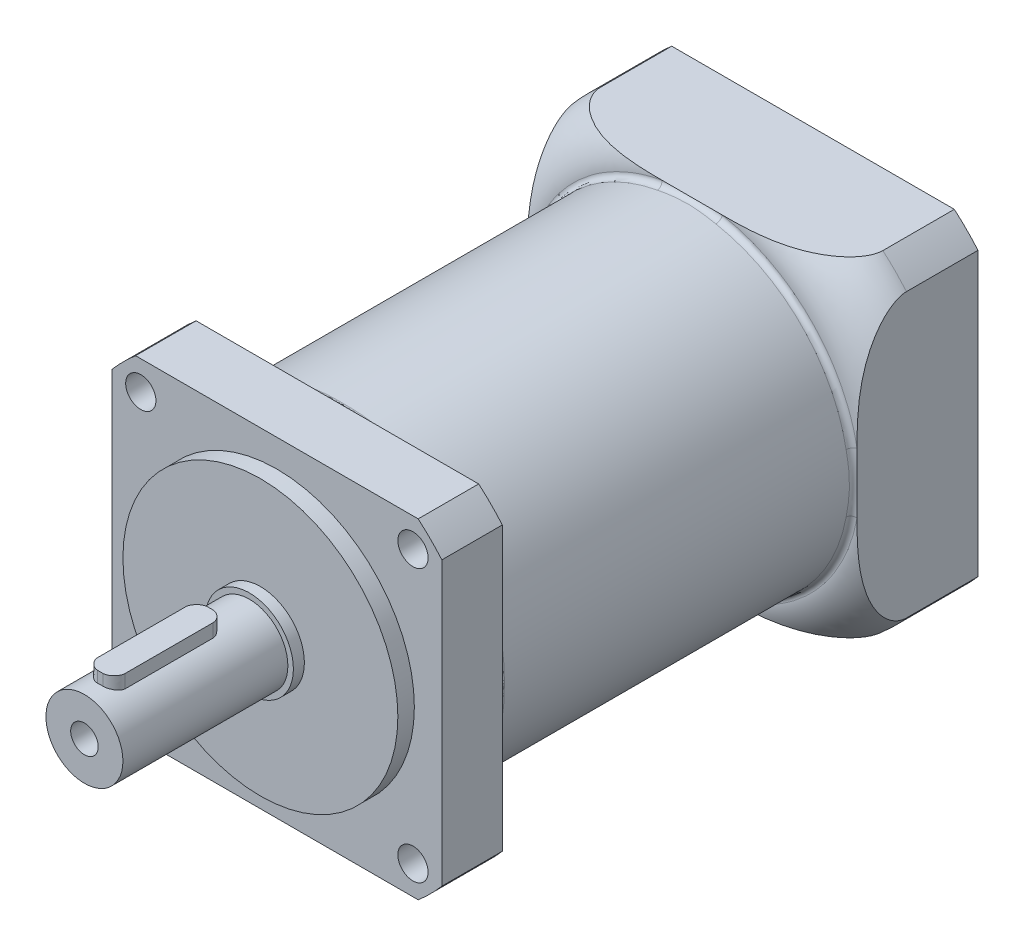
from build123d import *

# Parameters (mm, degrees)
ESQUISSE1_W             = 60
ESQUISSE1_H             = 60
BOSS_EXTRU_1_DEPTH      = 22
ESQUISSE3_R             = 29.5
BOSS_EXTRU_2_DEPTH      = 64.5
ESQUISSE4_W             = 60
ESQUISSE4_H             = 60
BOSS_EXTRU_3_DEPTH      = 11
ESQUISSE5_R             = 25
BOSS_EXTRU_4_DEPTH      = 3
ESQUISSE6_OUTSIDE_W     = 88.306
ESQUISSE6_OUTSIDE_H     = 88.306
ESQUISSE6_OUTSIDE_R     = 39.5
ENL_V_MAT_EXTRU_1_DEPTH = 107.330851591
ESQUISSE7_R             = 2.75
ENL_V_MAT_EXTRU_2_DEPTH = 11
CONG_1_R                = 1
ESQUISSE8_R             = 2
ENL_V_MAT_EXTRU_3_DEPTH = 8
CONG_2_SIZE             = 9
CONG_3_R                = 1
ESQUISSE9_R             = 7
BOSS_EXTRU_5_DEPTH      = 32
ESQUISSE10_R            = 8
BOSS_EXTRU_6_DEPTH      = 2
ESQUISSE11_R            = 19.05
ENL_V_MAT_EXTRU_4_DEPTH = 4
ESQUISSE12_R            = 4
ENL_V_MAT_EXTRU_5_DEPTH = 27
ESQUISSE13_W            = 5
ESQUISSE13_H            = 7.092268396
BOSS_EXTRU_7_DEPTH      = 20
CONG_4_SIZE             = 2
ESQUISSE14_R            = 2.5
ENL_V_MAT_EXTRU_6_DEPTH = 18
ESQUISSE15_R            = 15
ESQUISSE15_R_2          = 13
ENL_V_MAT_EXTRU_7_DEPTH = 2


# Some blends are built 0.0001 mm under size
with BuildPart() as part:
    # Esquisse1 → Boss.-Extru.1 (new body)
    with BuildSketch(Plane.XY):
        Rectangle(ESQUISSE1_W, ESQUISSE1_H)
    extrude(amount=BOSS_EXTRU_1_DEPTH)

    # Esquisse3 → Boss.-Extru.2 (add)
    with BuildSketch(Plane.XY.offset(22)):
        Circle(ESQUISSE3_R)
    extrude(amount=BOSS_EXTRU_2_DEPTH)

    # Esquisse4 → Boss.-Extru.3 (add)
    with BuildSketch(Plane.XY.offset(86.5)):
        Rectangle(ESQUISSE4_W, ESQUISSE4_H)
    extrude(amount=BOSS_EXTRU_3_DEPTH)

    # Esquisse5 → Boss.-Extru.4 (add)
    with BuildSketch(Plane.XY.offset(97.5)):
        Circle(ESQUISSE5_R)
    extrude(amount=BOSS_EXTRU_4_DEPTH)

    # Esquisse6 outside → Enlèv. mat.-Extru.1 (cut, through all)
    with BuildSketch(Plane.XY.offset(97.5)):
        Rectangle(ESQUISSE6_OUTSIDE_W, ESQUISSE6_OUTSIDE_H)
        Circle(ESQUISSE6_OUTSIDE_R, mode=Mode.SUBTRACT)
    extrude(amount=-ENL_V_MAT_EXTRU_1_DEPTH, mode=Mode.SUBTRACT)

    # Esquisse7 → Enlèv. mat.-Extru.2 (cut)
    with BuildSketch(Plane.XY.offset(97.5)):
        with Locations((24.748737342, 24.748737342)):
            Circle(ESQUISSE7_R)
        with Locations((24.748737342, -24.748737342)):
            Circle(ESQUISSE7_R)
        with Locations((-24.748737342, -24.748737342)):
            Circle(ESQUISSE7_R)
        with Locations((-24.748737342, 24.748737342)):
            Circle(ESQUISSE7_R)
    extrude(amount=-ENL_V_MAT_EXTRU_2_DEPTH, mode=Mode.SUBTRACT)

    # Congé1
    cong_1_edges = [part.edges().sort_by_distance(p)[0] for p in [
        (-29.5, 0, 86.5),
    ]]
    fillet(cong_1_edges, radius=CONG_1_R)

    # Esquisse8 → Enlèv. mat.-Extru.3 (cut)
    with BuildSketch(Plane(origin=(0, 0, 0), x_dir=(-1, 0, 0), z_dir=(0, 0, -1))):
        with Locations((23.582011153, 23.582011153)):
            Circle(ESQUISSE8_R)
        with Locations((23.582011153, -23.582011153)):
            Circle(ESQUISSE8_R)
        with Locations((-23.582011153, -23.582011153)):
            Circle(ESQUISSE8_R)
        with Locations((-23.582011153, 23.582011153)):
            Circle(ESQUISSE8_R)
    extrude(amount=-ENL_V_MAT_EXTRU_3_DEPTH, mode=Mode.SUBTRACT)

    # Congé2
    # a fillet whose section is not a circle: 9 mm, written as the material it takes off along each edge
    with BuildSketch(Plane(origin=(0, 0, 22), x_dir=(0.13819575513631774, -0.9904049339852377, 0), z_dir=(-0.9904049339852377, -0.13819575513631774, 0))) as cong_2_piece_1:
        with BuildLine():
            Bezier((39.5 - CONG_2_SIZE, 0), (39.5, 0), (39.5, -CONG_2_SIZE), weights=[1, 0.538461538, 1])
            Line((39.5, -CONG_2_SIZE), (39.5, 0))
            Line((39.5, 0), (39.5 - CONG_2_SIZE, 0))
        make_face()
    revolve(axis=Axis((0, 0, 22), (0, 0, 1)), revolution_arc=74.113088402, mode=Mode.SUBTRACT)
    with BuildSketch(Plane(origin=(0, 0, 22), x_dir=(0.9904049339852377, 0.1381957551363177, 0), z_dir=(0.1381957551363177, -0.9904049339852377, 0))) as cong_2_piece_2:
        with BuildLine():
            Bezier((39.5 - CONG_2_SIZE, 0), (39.5, 0), (39.5, -CONG_2_SIZE), weights=[1, 0.538461538, 1])
            Line((39.5, -CONG_2_SIZE), (39.5, 0))
            Line((39.5, 0), (39.5 - CONG_2_SIZE, 0))
        make_face()
    revolve(axis=Axis((0, 0, 22), (0, 0, 1)), revolution_arc=74.113088402, mode=Mode.SUBTRACT)
    with BuildSketch(Plane(origin=(0, 0, 22), x_dir=(-0.9904049339852375, -0.13819575513631824, 0), z_dir=(-0.13819575513631824, 0.9904049339852375, 0))) as cong_2_piece_3:
        with BuildLine():
            Bezier((39.5 - CONG_2_SIZE, 0), (39.5, 0), (39.5, -CONG_2_SIZE), weights=[1, 0.538461538, 1])
            Line((39.5, -CONG_2_SIZE), (39.5, 0))
            Line((39.5, 0), (39.5 - CONG_2_SIZE, 0))
        make_face()
    revolve(axis=Axis((0, 0, 22), (0, 0, 1)), revolution_arc=74.113088402, mode=Mode.SUBTRACT)
    with BuildSketch(Plane(origin=(0, 0, 22), x_dir=(-0.13819575513631788, 0.9904049339852377, 0), z_dir=(0.9904049339852377, 0.13819575513631788, 0))) as cong_2_piece_4:
        with BuildLine():
            Bezier((39.5 - CONG_2_SIZE, 0), (39.5, 0), (39.5, -CONG_2_SIZE), weights=[1, 0.538461538, 1])
            Line((39.5, -CONG_2_SIZE), (39.5, 0))
            Line((39.5, 0), (39.5 - CONG_2_SIZE, 0))
        make_face()
    revolve(axis=Axis((0, 0, 22), (0, 0, 1)), revolution_arc=74.113088402, mode=Mode.SUBTRACT)

    # Congé3
    cong_3_edges = [part.edges().sort_by_distance(p)[0] for p in [
        (-29.5, 0, 22),
    ]]
    fillet(cong_3_edges, radius=CONG_3_R - 0.0001)  # a hair under: the kernel refuses the full size

    # Esquisse9 → Boss.-Extru.5 (add)
    with BuildSketch(Plane.XY.offset(100.5)):
        Circle(ESQUISSE9_R)
    extrude(amount=BOSS_EXTRU_5_DEPTH)

    # Esquisse10 → Boss.-Extru.6 (add)
    with BuildSketch(Plane.XY.offset(100.5)):
        Circle(ESQUISSE10_R)
    extrude(amount=BOSS_EXTRU_6_DEPTH)

    # Esquisse11 → Enlèv. mat.-Extru.4 (cut)
    with BuildSketch(Plane(origin=(0, 0, 0), x_dir=(-1, 0, 0), z_dir=(0, 0, -1))):
        Circle(ESQUISSE11_R)
    extrude(amount=-ENL_V_MAT_EXTRU_4_DEPTH, mode=Mode.SUBTRACT)

    # Esquisse12 → Enlèv. mat.-Extru.5 (cut)
    with BuildSketch(Plane(origin=(0, 0, 4), x_dir=(-1, 0, 0), z_dir=(0, 0, -1))):
        Circle(ESQUISSE12_R)
    extrude(amount=-ENL_V_MAT_EXTRU_5_DEPTH, mode=Mode.SUBTRACT)


with BuildPart() as body_2:
    # Esquisse13 → Boss.-Extru.7 (new body)
    with BuildSketch(Plane.XY.offset(129.5)):
        with Locations((-0.103377257, 5.453865802)):
            Rectangle(ESQUISSE13_W, ESQUISSE13_H)
    extrude(amount=-BOSS_EXTRU_7_DEPTH)

    # Congé4
    # a fillet whose section is not a circle: 2 mm, written as the material it takes off along each edge
    with BuildSketch(Plane(origin=(-2.603377257, -3.092268396, 109.5), x_dir=(0, 0, 1), z_dir=(0, 1, 0)), Plane(origin=(2.396622743, 14, 109.5), x_dir=(0, 0, 1), z_dir=(0, -1, 0))) as cong_4_piece_1:
        with BuildLine():
            Bezier((CONG_4_SIZE, 0), (0, 0), (0, CONG_4_SIZE), weights=[1, 0.538461538, 1])
            Line((0, CONG_4_SIZE), (0, 0))
            Line((0, 0), (CONG_4_SIZE, 0))
        make_face()
    extrude(amount=17.092268396, mode=Mode.SUBTRACT)
    with BuildSketch(Plane(origin=(2.396622743, 14, 129.5), x_dir=(0, 0, -1), z_dir=(0, -1, 0)), Plane(origin=(-2.603377257, -3.092268396, 129.5), x_dir=(0, 0, -1), z_dir=(0, 1, 0))) as cong_4_piece_2:
        with BuildLine():
            Bezier((CONG_4_SIZE, 0), (0, 0), (0, -CONG_4_SIZE), weights=[1, 0.538461538, 1])
            Line((0, -CONG_4_SIZE), (0, 0))
            Line((0, 0), (CONG_4_SIZE, 0))
        make_face()
    extrude(amount=17.092268396, mode=Mode.SUBTRACT)


with BuildPart() as enl_v_mat_extru_6_tool:
    # Esquisse14 → Enlèv. mat.-Extru.6 (new body)
    with BuildSketch(Plane.XY.offset(132.5)):
        Circle(ESQUISSE14_R)
    extrude(amount=-ENL_V_MAT_EXTRU_6_DEPTH)


with BuildPart() as part_1:
    add(part.part)

    # Enlèv. mat.-Extru.6: cut by enl_v_mat_extru_6_tool
    add(enl_v_mat_extru_6_tool.part, mode=Mode.SUBTRACT)

    # Esquisse15 → Enlèv. mat.-Extru.7 (cut)
    with BuildSketch(Plane(origin=(0, 0, 4), x_dir=(-1, 0, 0), z_dir=(0, 0, -1))):
        Circle(ESQUISSE15_R)
        Circle(ESQUISSE15_R_2, mode=Mode.SUBTRACT)
    extrude(amount=-ENL_V_MAT_EXTRU_7_DEPTH, mode=Mode.SUBTRACT)


with BuildPart() as body_2_1:
    add(body_2.part)

    # Enlèv. mat.-Extru.6: cut by enl_v_mat_extru_6_tool
    add(enl_v_mat_extru_6_tool.part, mode=Mode.SUBTRACT)


solid = Compound([part_1.part, body_2_1.part])
